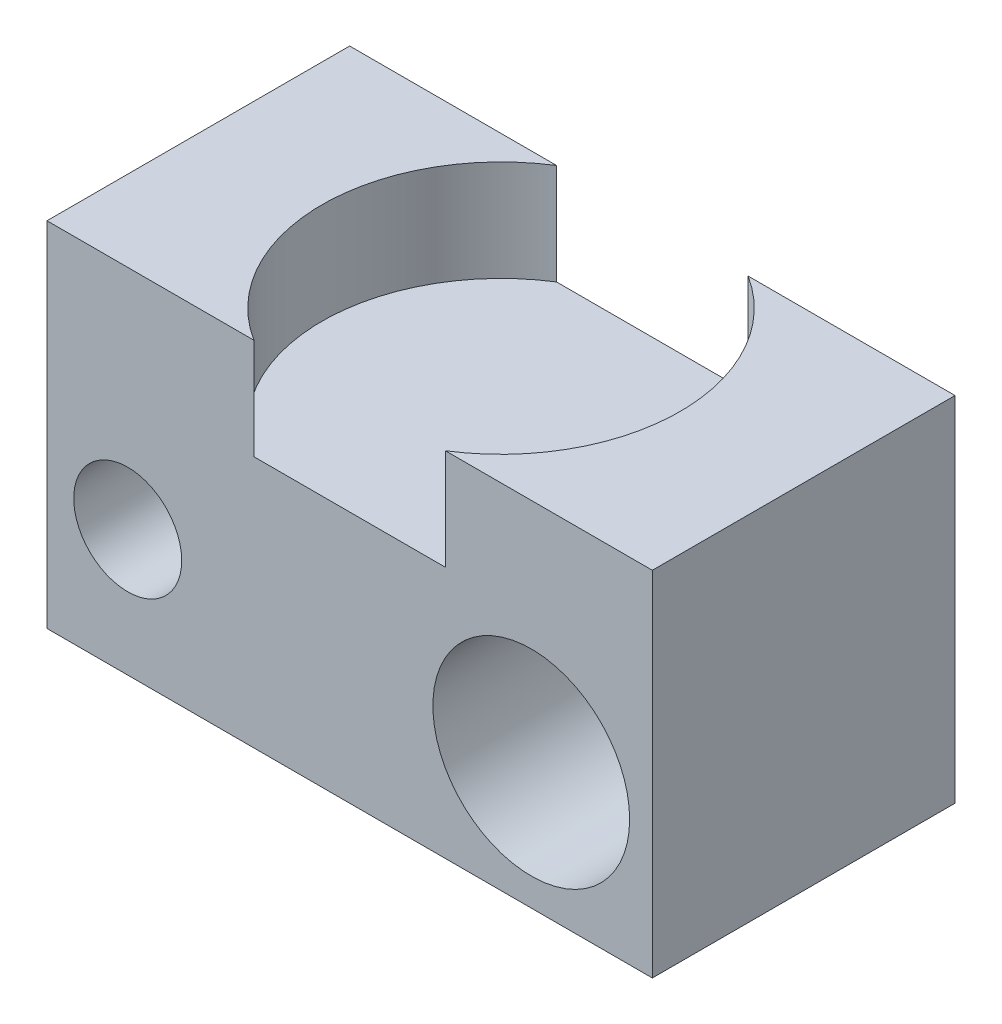
from build123d import *

# Parameters (mm, degrees)
SKETCH1_W           = 60
SKETCH1_H           = 25
SKETCH1_R           = 9.75
SKETCH1_R_2         = 5.35
BOSS_EXTRUDE1_DEPTH = 30
BOSS_EXTRUDE2_DEPTH = 10


with BuildPart() as part:
    # Sketch1 → Boss-Extrude1 (new body)
    with BuildSketch(Plane.XY):
        Rectangle(SKETCH1_W, SKETCH1_H)
        with Locations((18, 0)):
            Circle(SKETCH1_R, mode=Mode.SUBTRACT)
        with Locations((-22, 0)):
            Circle(SKETCH1_R_2, mode=Mode.SUBTRACT)
    extrude(amount=BOSS_EXTRUDE1_DEPTH)

    # Sketch2 → Boss-Extrude2 (add)
    with BuildSketch(Plane(origin=(0, 12.5, 0), x_dir=(1, 0, 0), z_dir=(0, 1, 0))):
        with BuildLine():
            ThreePointArc((9.490126448, 0), (17.75, -15), (9.490126448, -30))
            Line((9.490126448, -30), (30, -30))
            Line((30, -30), (30, 0))
            Line((30, 0), (9.490126448, 0))
        make_face()
        with BuildLine():
            ThreePointArc((-9.490126448, -30), (-17.75, -15), (-9.490126448, 0))
            Line((-9.490126448, 0), (-30, 0))
            Line((-30, 0), (-30, -30))
            Line((-30, -30), (-9.490126448, -30))
        make_face()
    extrude(amount=BOSS_EXTRUDE2_DEPTH)


solid = part.part
